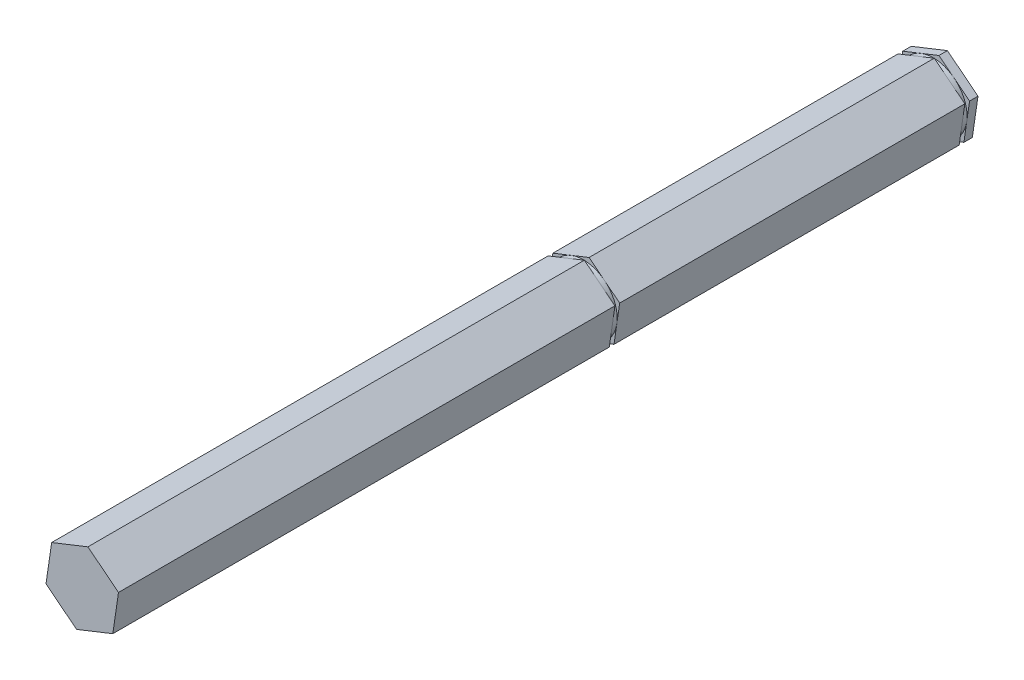
from build123d import *

# Parameters (mm, degrees)
BOSS_EXTRUDE1_DEPTH = 161.6075
SKETCH3_R           = 7.62
SKETCH3_R_2         = 6.35
CUT_EXTRUDE1_DEPTH  = 0.889
CUT_EXTRUDE2_START  = -0.889
SKETCH4_R           = 7.62
SKETCH4_R_2         = 6.35
CUT_EXTRUDE2_DEPTH  = 0.889


with BuildPart() as part:
    # Sketch1 → Boss-Extrude1 (new body)
    with BuildSketch(Plane.XY):
        Polygon((1.064896502, 7.254607417), (-5.750226067, 4.549531131), (-6.815122568, -2.705076286), (-1.064896502, -7.254607417), (5.750226067, -4.549531131), (6.815122568, 2.705076286), align=None)
    extrude(amount=BOSS_EXTRUDE1_DEPTH)

    # Sketch3 → Cut-Extrude1 (cut)
    with BuildSketch(Plane.XY.offset(68.2625)):
        Circle(SKETCH3_R)
        Circle(SKETCH3_R_2, mode=Mode.SUBTRACT)
    extrude(amount=-CUT_EXTRUDE1_DEPTH, mode=Mode.SUBTRACT)

    # Sketch4 → Cut-Extrude2 (cut)
    with BuildSketch(Plane(origin=(0, 0, 1.5875), x_dir=(-1, 0, 0), z_dir=(0, 0, -1)).offset(CUT_EXTRUDE2_START)):
        Circle(SKETCH4_R)
        Circle(SKETCH4_R_2, mode=Mode.SUBTRACT)
    extrude(amount=CUT_EXTRUDE2_DEPTH, mode=Mode.SUBTRACT)


solid = part.part
